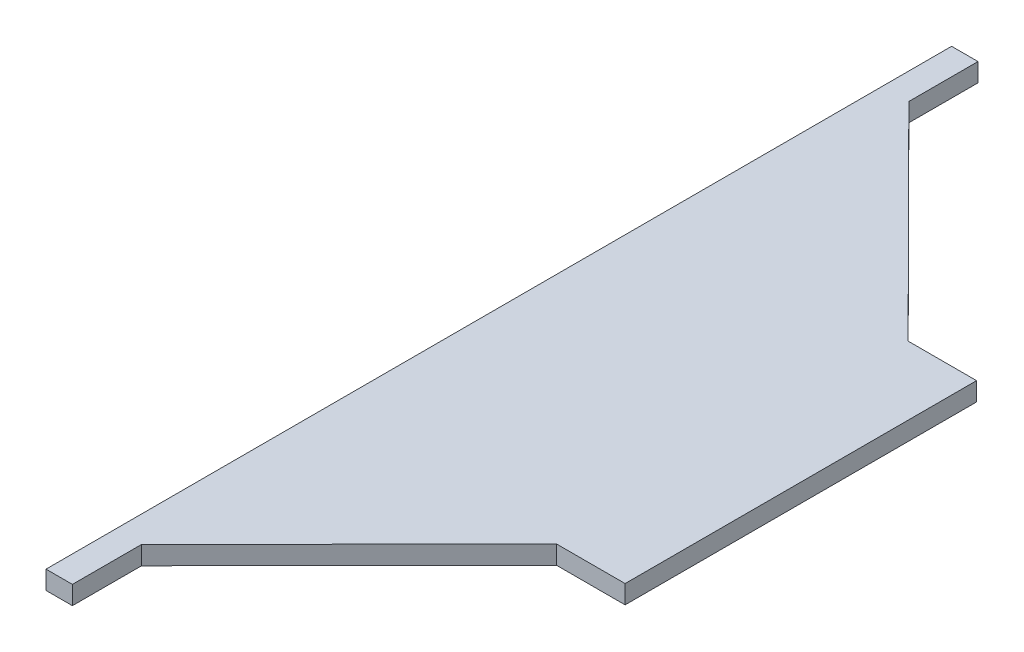
from build123d import *

# Parameters (mm, degrees)
SALIENTE_EXTRUIR1_DEPTH = 2.1


with BuildPart() as part:
    # Croquis1 → Saliente-Extruir1 (new body)
    with BuildSketch(Plane(origin=(0, 0, 0), x_dir=(1, 0, 0), z_dir=(0, 1, 0))):
        Polygon((0, 0), (0, -102.91), (3, -102.91), (3, -95.05), (26.54267679, -71.425), (34.32267679, -71.425), (34.32267679, -31.485), (26.54267679, -31.485), (3, -7.86), (3, 0), align=None)
    extrude(amount=SALIENTE_EXTRUIR1_DEPTH)


solid = part.part
